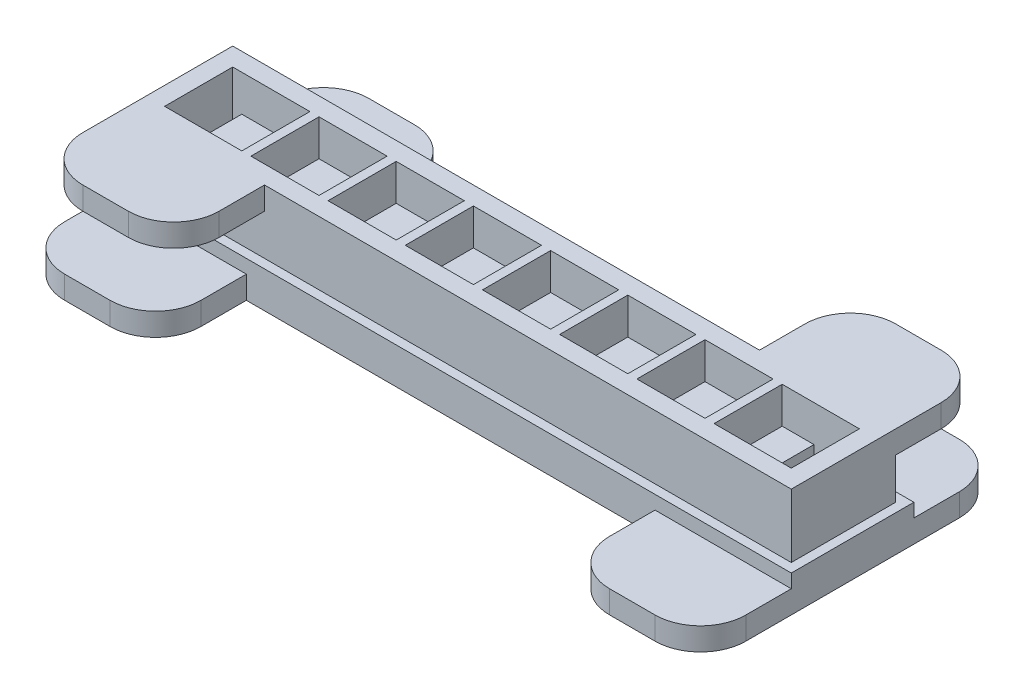
from build123d import *

# Parameters (mm, degrees)
SKETCH1_W            = 15
SKETCH1_H            = 15
BOSS_EXTRUDE1_DEPTH  = 15
SKETCH2_W            = 7
SKETCH2_H            = 7
CUT_EXTRUDE1_DEPTH   = 11
SKETCH3_W            = 15
SKETCH3_H            = 3
BOSS_EXTRUDE2_DEPTH  = 2
LPATTERN1_COUNT      = 8
LPATTERN1_PITCH      = 17
SKETCH4_W            = 15
SKETCH4_H            = 12
BOSS_EXTRUDE3_DEPTH  = 2
SKETCH5_W            = 15
SKETCH5_H            = 15
BOSS_EXTRUDE4_DEPTH  = 2
SKETCH6_W            = 112
SKETCH6_H            = 2.5
CUT_EXTRUDE2_DEPTH   = 2
SKETCH9_W            = 130
SKETCH9_H            = 11
SKETCH9_W_2          = 126
SKETCH9_H_2          = 7
BOSS_EXTRUDE6_DEPTH  = 3
SKETCH12_W           = 8
SKETCH12_H           = 0.25
BOSS_EXTRUDE7_DEPTH  = 3
LPATTERN2_COUNT      = 7
LPATTERN2_PITCH      = 17
SKETCH13_W           = 146
SKETCH13_H           = 23
BOSS_EXTRUDE8_DEPTH  = 22
SPLIT1_START         = -7
SPLIT1_OUTLINE_W     = 146
SPLIT1_OUTLINE_H     = 23
SPLIT1_DEPTH         = 7
SPLIT1_2_OUTLINE_W   = 7
SPLIT1_2_OUTLINE_H   = 7
SPLIT1_2_DEPTH       = 11
SPLIT1_3_OUTLINE_W   = 10
SPLIT1_3_OUTLINE_H   = 2.5
SPLIT1_3_DEPTH       = 2
SPLIT1_START_2       = -4
SPLIT1_4_DEPTH       = 23
SPLIT1_START_3       = 4
SPLIT1_5_DEPTH       = 7
SPLIT1_6_OUTLINE_W   = 130
SPLIT1_6_OUTLINE_H   = 3
SPLIT1_6_DEPTH       = 6
SPLIT1_START_4       = 13
SPLIT1_7_OUTLINE_W   = 130
SPLIT1_7_OUTLINE_H   = 3
SPLIT1_7_DEPTH       = 6
SPLIT1_START_5       = 6.25
SPLIT1_8_DEPTH       = 2.5
SPLIT1_START_6       = 5.25
SPLIT1_9_OUTLINE_W   = 8
SPLIT1_9_OUTLINE_H   = 3
SPLIT1_9_DEPTH       = 4.5
SPLIT1_10_OUTLINE_W  = 8
SPLIT1_10_OUTLINE_H  = 3
SPLIT1_10_DEPTH      = 1
SPLIT1_START_7       = 10
SPLIT1_11_OUTLINE_W  = 8
SPLIT1_11_OUTLINE_H  = 3
SPLIT1_11_DEPTH      = 1
SKETCH14_W           = 30
SKETCH14_H           = 5
BOSS_EXTRUDE9_DEPTH  = 20
FILLET1_R            = 10
SKETCH15_W           = 30
SKETCH15_H           = 5
BOSS_EXTRUDE10_DEPTH = 20
FILLET2_R            = 10
SKETCH16_W           = 150
SKETCH16_H           = 27
SKETCH16_W_2         = 146
SKETCH16_H_2         = 23
BOSS_EXTRUDE11_DEPTH = 8
SKETCH17_W           = 30
SKETCH17_H           = 5
BOSS_EXTRUDE12_DEPTH = 20
FILLET3_R            = 10
SKETCH18_W           = 30
SKETCH18_H           = 5
BOSS_EXTRUDE13_DEPTH = 20
FILLET4_R            = 10
SKETCH19_W           = 30
SKETCH19_H           = 5
BOSS_EXTRUDE14_DEPTH = 20
FILLET5_R            = 10


# Read off the part's stored shape, not the designer's step: Split1
with BuildPart() as part:
    # Sketch1 → Boss-Extrude1 (new body)
    with BuildSketch(Plane.XY):
        with Locations((7.5, 7.5)):
            Rectangle(SKETCH1_W, SKETCH1_H)
    extrude(amount=BOSS_EXTRUDE1_DEPTH)

    # Sketch2 → Cut-Extrude1 (cut)
    with BuildSketch(Plane.XZ):
        with Locations((7.5, 7.5)):
            Rectangle(SKETCH2_W, SKETCH2_H)
    extrude(amount=-CUT_EXTRUDE1_DEPTH, mode=Mode.SUBTRACT)

    # Sketch3 → Boss-Extrude2 (add)
    with BuildSketch(Plane(origin=(15, 0, 0), x_dir=(0, 0, -1), z_dir=(1, 0, 0))):
        with Locations((-7.5, 1.5)):
            Rectangle(SKETCH3_W, SKETCH3_H)
    extrude(amount=BOSS_EXTRUDE2_DEPTH)


with BuildPart() as lpattern1_1:
    # LPattern1: pattern copy
    add(part.part.moved(Location(Vector(1, 0, 0) * (1 * LPATTERN1_PITCH))))


with BuildPart() as lpattern1_2:
    # LPattern1: pattern copy
    add(part.part.moved(Location(Vector(1, 0, 0) * (2 * LPATTERN1_PITCH))))


with BuildPart() as lpattern1_3:
    # LPattern1: pattern copy
    add(part.part.moved(Location(Vector(1, 0, 0) * (3 * LPATTERN1_PITCH))))


with BuildPart() as lpattern1_4:
    # LPattern1: pattern copy
    add(part.part.moved(Location(Vector(1, 0, 0) * (4 * LPATTERN1_PITCH))))


with BuildPart() as lpattern1_5:
    # LPattern1: pattern copy
    add(part.part.moved(Location(Vector(1, 0, 0) * (5 * LPATTERN1_PITCH))))


with BuildPart() as lpattern1_6:
    # LPattern1: pattern copy
    add(part.part.moved(Location(Vector(1, 0, 0) * (6 * LPATTERN1_PITCH))))


with BuildPart() as lpattern1_7:
    # LPattern1: pattern copy
    add(part.part.moved(Location(Vector(1, 0, 0) * (7 * LPATTERN1_PITCH))))


with BuildPart() as lpattern1_3_1:
    add(lpattern1_3.part)

    # Combine1: union LPattern1_4, LPattern1_5, part, LPattern1_6, LPattern1_7, LPattern1_1, LPattern1_2
    add(lpattern1_4.part)
    add(lpattern1_5.part)
    add(part.part)
    add(lpattern1_6.part)
    add(lpattern1_7.part)
    add(lpattern1_1.part)
    add(lpattern1_2.part)

    # Sketch4 → Boss-Extrude3 (add)
    with BuildSketch(Plane(origin=(134, 0, 0), x_dir=(0, 0, -1), z_dir=(1, 0, 0))):
        with Locations((-7.5, 9)):
            Rectangle(SKETCH4_W, SKETCH4_H)
    extrude(amount=BOSS_EXTRUDE3_DEPTH)

    # Sketch5 → Boss-Extrude4 (add)
    with BuildSketch(Plane.ZY):
        with Locations((7.5, 7.5)):
            Rectangle(SKETCH5_W, SKETCH5_H)
    extrude(amount=BOSS_EXTRUDE4_DEPTH)

    # Sketch6 → Cut-Extrude2 (cut)
    with BuildSketch(Plane.XZ):
        with Locations((67, 7.5)):
            Rectangle(SKETCH6_W, SKETCH6_H)
    extrude(amount=-CUT_EXTRUDE2_DEPTH, mode=Mode.SUBTRACT)

    # Sketch9 → Boss-Extrude6 (add)
    with BuildSketch(Plane.XZ):
        with Locations((67, 7.5)):
            Rectangle(SKETCH9_W, SKETCH9_H)
        with Locations((67, 7.5)):
            Rectangle(SKETCH9_W_2, SKETCH9_H_2, mode=Mode.SUBTRACT)
    extrude(amount=BOSS_EXTRUDE6_DEPTH)

    # Sketch12 → Boss-Extrude7 (add)
    with BuildSketch(Plane.XZ):
        with Locations((16, 5.125)):
            Rectangle(SKETCH12_W, SKETCH12_H)
        with Locations((16, 9.875)):
            Rectangle(SKETCH12_W, SKETCH12_H)
    boss_extrude7 = extrude(amount=BOSS_EXTRUDE7_DEPTH)

    # LPattern2: Boss-Extrude7 ×7
    with Locations(*[(i * LPATTERN2_PITCH, 0, 0) for i in range(1, LPATTERN2_COUNT)]):
        add(boss_extrude7)


with BuildPart() as body_2:
    # Sketch13 → Boss-Extrude8 (new body)
    with BuildSketch(Plane(origin=(0, 15, 0), x_dir=(1, 0, 0), z_dir=(0, 1, 0))):
        with Locations((67, -7.5)):
            Rectangle(SKETCH13_W, SKETCH13_H)
    extrude(amount=-BOSS_EXTRUDE8_DEPTH)

    # Combine2: cut LPattern1_3
    add(lpattern1_3_1.part, mode=Mode.SUBTRACT)

    # Split1 outline → Split1 (cut)
    with BuildSketch(Plane(origin=(0, 0, 0), x_dir=(1, 0, 0), z_dir=(0, 1, 0)).offset(SPLIT1_START)):
        with Locations((67, -7.5)):
            Rectangle(SPLIT1_OUTLINE_W, SPLIT1_OUTLINE_H)
    extrude(amount=SPLIT1_DEPTH, mode=Mode.SUBTRACT)

    # Split1 2 outline → Split1 2 (cut)
    with BuildSketch(Plane(origin=(0, 0, 0), x_dir=(1, 0, 0), z_dir=(0, 1, 0))):
        with Locations((24.5, -7.5)):
            Rectangle(SPLIT1_2_OUTLINE_W, SPLIT1_2_OUTLINE_H)
        with Locations((7.5, -7.5)):
            Rectangle(SPLIT1_2_OUTLINE_W, SPLIT1_2_OUTLINE_H)
        with Locations((41.5, -7.5)):
            Rectangle(SPLIT1_2_OUTLINE_W, SPLIT1_2_OUTLINE_H)
        with Locations((58.5, -7.5)):
            Rectangle(SPLIT1_2_OUTLINE_W, SPLIT1_2_OUTLINE_H)
        with Locations((75.5, -7.5)):
            Rectangle(SPLIT1_2_OUTLINE_W, SPLIT1_2_OUTLINE_H)
        with Locations((92.5, -7.5)):
            Rectangle(SPLIT1_2_OUTLINE_W, SPLIT1_2_OUTLINE_H)
        with Locations((109.5, -7.5)):
            Rectangle(SPLIT1_2_OUTLINE_W, SPLIT1_2_OUTLINE_H)
        with Locations((126.5, -7.5)):
            Rectangle(SPLIT1_2_OUTLINE_W, SPLIT1_2_OUTLINE_H)
    extrude(amount=SPLIT1_2_DEPTH, mode=Mode.SUBTRACT)

    # Split1 3 outline → Split1 3 (cut)
    with BuildSketch(Plane(origin=(0, 0, 0), x_dir=(1, 0, 0), z_dir=(0, 1, 0))):
        with Locations((16, -7.5)):
            Rectangle(SPLIT1_3_OUTLINE_W, SPLIT1_3_OUTLINE_H)
        with Locations((33, -7.5)):
            Rectangle(SPLIT1_3_OUTLINE_W, SPLIT1_3_OUTLINE_H)
        with Locations((50, -7.5)):
            Rectangle(SPLIT1_3_OUTLINE_W, SPLIT1_3_OUTLINE_H)
        with Locations((67, -7.5)):
            Rectangle(SPLIT1_3_OUTLINE_W, SPLIT1_3_OUTLINE_H)
        with Locations((84, -7.5)):
            Rectangle(SPLIT1_3_OUTLINE_W, SPLIT1_3_OUTLINE_H)
        with Locations((101, -7.5)):
            Rectangle(SPLIT1_3_OUTLINE_W, SPLIT1_3_OUTLINE_H)
        with Locations((118, -7.5)):
            Rectangle(SPLIT1_3_OUTLINE_W, SPLIT1_3_OUTLINE_H)
    extrude(amount=SPLIT1_3_DEPTH, mode=Mode.SUBTRACT)

    # Sketch14 → Boss-Extrude9 (add)
    with BuildSketch(Plane.XY.offset(19)):
        with Locations((9, 12.5)):
            Rectangle(SKETCH14_W, SKETCH14_H)
    extrude(amount=BOSS_EXTRUDE9_DEPTH)

    # Fillet1
    fillet1_edges = [body_2.edges().sort_by_distance(p)[0] for p in [
        (-6, 12.5, 39),
        (24, 12.5, 39),
    ]]
    fillet(fillet1_edges, radius=FILLET1_R)

    # Sketch15 → Boss-Extrude10 (add)
    with BuildSketch(Plane(origin=(0, 0, -4), x_dir=(-1, 0, 0), z_dir=(0, 0, -1))):
        with Locations((-125, 12.5)):
            Rectangle(SKETCH15_W, SKETCH15_H)
    extrude(amount=BOSS_EXTRUDE10_DEPTH)

    # Fillet2
    fillet2_edges = [body_2.edges().sort_by_distance(p)[0] for p in [
        (140, 12.5, -24),
        (110, 12.5, -24),
    ]]
    fillet(fillet2_edges, radius=FILLET2_R)


with BuildPart() as body_2_2:
    # Split1 4 outline → Split1 4 (new body)
    with BuildSketch(Plane.XY.offset(SPLIT1_START_2)):
        Polygon((132, -3), (2, -3), (2, 0), (-6, 0), (-6, -7), (140, -7), (140, 0), (132, 0), align=None)
    extrude(amount=SPLIT1_4_DEPTH)

    # Split1 5 outline → Split1 5 (add)
    with BuildSketch(Plane.XY.offset(SPLIT1_START_3)):
        Polygon((11, 0), (11, 11), (4, 11), (4, -3), (12, -3), (12, 0), align=None)
        Polygon((21, 11), (21, 0), (20, 0), (20, -3), (29, -3), (29, 0), (28, 0), (28, 11), align=None)
        Polygon((38, 11), (38, 0), (37, 0), (37, -3), (46, -3), (46, 0), (45, 0), (45, 11), align=None)
        Polygon((54, 0), (54, -3), (63, -3), (63, 0), (62, 0), (62, 11), (55, 11), (55, 0), align=None)
        Polygon((123, 0), (122, 0), (122, -3), (130, -3), (130, 11), (123, 11), align=None)
        Polygon((71, 0), (71, -3), (80, -3), (80, 0), (79, 0), (79, 11), (72, 11), (72, 0), align=None)
        Polygon((88, 0), (88, -3), (97, -3), (97, 0), (96, 0), (96, 11), (89, 11), (89, 0), align=None)
        Polygon((105, -3), (114, -3), (114, 0), (113, 0), (113, 11), (106, 11), (106, 0), (105, 0), align=None)
    extrude(amount=SPLIT1_5_DEPTH)

    # Split1 6 outline → Split1 6 (add)
    with BuildSketch(Plane.XY.offset(SPLIT1_START_2)):
        with Locations((67, -1.5)):
            Rectangle(SPLIT1_6_OUTLINE_W, SPLIT1_6_OUTLINE_H)
    extrude(amount=SPLIT1_6_DEPTH)

    # Split1 7 outline → Split1 7 (add)
    with BuildSketch(Plane.XY.offset(SPLIT1_START_4)):
        with Locations((67, -1.5)):
            Rectangle(SPLIT1_7_OUTLINE_W, SPLIT1_7_OUTLINE_H)
    extrude(amount=SPLIT1_7_DEPTH)

    # Split1 8 outline → Split1 8 (add)
    with BuildSketch(Plane.XY.offset(SPLIT1_START_5)):
        Polygon((21, 2), (11, 2), (11, 0), (12, 0), (12, -3), (20, -3), (20, 0), (21, 0), align=None)
        Polygon((28, 2), (28, 0), (29, 0), (29, -3), (37, -3), (37, 0), (38, 0), (38, 2), align=None)
        Polygon((45, 2), (45, 0), (46, 0), (46, -3), (54, -3), (54, 0), (55, 0), (55, 2), align=None)
        Polygon((63, 0), (63, -3), (71, -3), (71, 0), (72, 0), (72, 2), (62, 2), (62, 0), align=None)
        Polygon((122, 0), (123, 0), (123, 2), (113, 2), (113, 0), (114, 0), (114, -3), (122, -3), align=None)
        Polygon((80, 0), (80, -3), (88, -3), (88, 0), (89, 0), (89, 2), (79, 2), (79, 0), align=None)
        Polygon((97, 0), (97, -3), (105, -3), (105, 0), (106, 0), (106, 2), (96, 2), (96, 0), align=None)
    extrude(amount=SPLIT1_8_DEPTH)

    # Split1 9 outline → Split1 9 (add)
    with BuildSketch(Plane.XY.offset(SPLIT1_START_6)):
        with Locations((16, -1.5)):
            Rectangle(SPLIT1_9_OUTLINE_W, SPLIT1_9_OUTLINE_H)
        with Locations((33, -1.5)):
            Rectangle(SPLIT1_9_OUTLINE_W, SPLIT1_9_OUTLINE_H)
        with Locations((50, -1.5)):
            Rectangle(SPLIT1_9_OUTLINE_W, SPLIT1_9_OUTLINE_H)
        with Locations((67, -1.5)):
            Rectangle(SPLIT1_9_OUTLINE_W, SPLIT1_9_OUTLINE_H)
        with Locations((84, -1.5)):
            Rectangle(SPLIT1_9_OUTLINE_W, SPLIT1_9_OUTLINE_H)
        with Locations((118, -1.5)):
            Rectangle(SPLIT1_9_OUTLINE_W, SPLIT1_9_OUTLINE_H)
        with Locations((101, -1.5)):
            Rectangle(SPLIT1_9_OUTLINE_W, SPLIT1_9_OUTLINE_H)
    extrude(amount=SPLIT1_9_DEPTH)

    # Split1 10 outline → Split1 10 (add)
    with BuildSketch(Plane.XY.offset(SPLIT1_START_3)):
        with Locations((16, -1.5)):
            Rectangle(SPLIT1_10_OUTLINE_W, SPLIT1_10_OUTLINE_H)
        with Locations((33, -1.5)):
            Rectangle(SPLIT1_10_OUTLINE_W, SPLIT1_10_OUTLINE_H)
        with Locations((50, -1.5)):
            Rectangle(SPLIT1_10_OUTLINE_W, SPLIT1_10_OUTLINE_H)
        with Locations((67, -1.5)):
            Rectangle(SPLIT1_10_OUTLINE_W, SPLIT1_10_OUTLINE_H)
        with Locations((84, -1.5)):
            Rectangle(SPLIT1_10_OUTLINE_W, SPLIT1_10_OUTLINE_H)
        with Locations((118, -1.5)):
            Rectangle(SPLIT1_10_OUTLINE_W, SPLIT1_10_OUTLINE_H)
        with Locations((101, -1.5)):
            Rectangle(SPLIT1_10_OUTLINE_W, SPLIT1_10_OUTLINE_H)
    extrude(amount=SPLIT1_10_DEPTH)

    # Split1 11 outline → Split1 11 (add)
    with BuildSketch(Plane.XY.offset(SPLIT1_START_7)):
        with Locations((16, -1.5)):
            Rectangle(SPLIT1_11_OUTLINE_W, SPLIT1_11_OUTLINE_H)
        with Locations((33, -1.5)):
            Rectangle(SPLIT1_11_OUTLINE_W, SPLIT1_11_OUTLINE_H)
        with Locations((50, -1.5)):
            Rectangle(SPLIT1_11_OUTLINE_W, SPLIT1_11_OUTLINE_H)
        with Locations((67, -1.5)):
            Rectangle(SPLIT1_11_OUTLINE_W, SPLIT1_11_OUTLINE_H)
        with Locations((84, -1.5)):
            Rectangle(SPLIT1_11_OUTLINE_W, SPLIT1_11_OUTLINE_H)
        with Locations((118, -1.5)):
            Rectangle(SPLIT1_11_OUTLINE_W, SPLIT1_11_OUTLINE_H)
        with Locations((101, -1.5)):
            Rectangle(SPLIT1_11_OUTLINE_W, SPLIT1_11_OUTLINE_H)
    extrude(amount=SPLIT1_11_DEPTH)

    # Sketch16 → Boss-Extrude11 (add)
    with BuildSketch(Plane.XZ.offset(7)):
        with Locations((67, 7.5)):
            Rectangle(SKETCH16_W, SKETCH16_H)
        with Locations((67, 7.5)):
            Rectangle(SKETCH16_W_2, SKETCH16_H_2, mode=Mode.SUBTRACT)
    extrude(amount=-BOSS_EXTRUDE11_DEPTH)

    # Sketch17 → Boss-Extrude12 (add)
    with BuildSketch(Plane.XY.offset(21)):
        with Locations((7, -4.5)):
            Rectangle(SKETCH17_W, SKETCH17_H)
    extrude(amount=BOSS_EXTRUDE12_DEPTH)

    # Fillet3
    fillet3_edges = [body_2_2.edges().sort_by_distance(p)[0] for p in [
        (-8, -4.5, 41),
        (22, -4.5, 41),
    ]]
    fillet(fillet3_edges, radius=FILLET3_R)

    # Sketch18 → Boss-Extrude13 (add)
    with BuildSketch(Plane.XY.offset(21)):
        with Locations((127, -4.5)):
            Rectangle(SKETCH18_W, SKETCH18_H)
    extrude(amount=BOSS_EXTRUDE13_DEPTH)

    # Fillet4
    fillet4_edges = [body_2_2.edges().sort_by_distance(p)[0] for p in [
        (142, -4.5, 41),
        (112, -4.5, 41),
    ]]
    fillet(fillet4_edges, radius=FILLET4_R)

    # Sketch19 → Boss-Extrude14 (add)
    with BuildSketch(Plane(origin=(0, 0, -6), x_dir=(-1, 0, 0), z_dir=(0, 0, -1))):
        with Locations((-7, -4.5)):
            Rectangle(SKETCH19_W, SKETCH19_H)
        with Locations((-127, -4.5)):
            Rectangle(SKETCH19_W, SKETCH19_H)
    extrude(amount=BOSS_EXTRUDE14_DEPTH)

    # Fillet5
    fillet5_edges = [body_2_2.edges().sort_by_distance(p)[0] for p in [
        (-8, -4.5, -26),
        (22, -4.5, -26),
        (142, -4.5, -26),
        (112, -4.5, -26),
    ]]
    fillet(fillet5_edges, radius=FILLET5_R)


solid = Compound([body_2.part, body_2_2.part])
